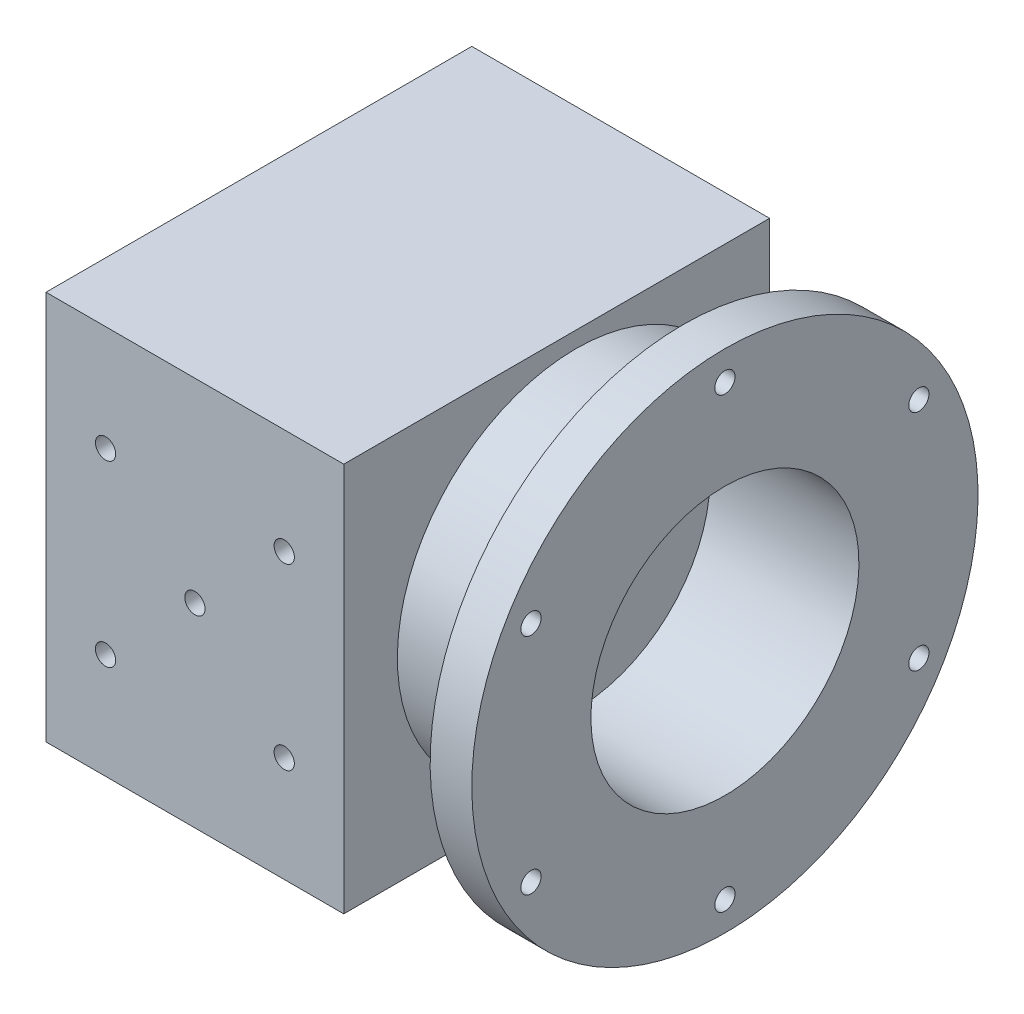
from build123d import *

# Parameters (mm, degrees)
CROQUIS1_W                            = 50
CROQUIS1_H                            = 65.4
SALIENTE_EXTRUIR1_DEPTH               = 35.75
CROQUIS2_R                            = 30
CROQUIS2_R_2                          = 22.5
SALIENTE_EXTRUIR2_DEPTH               = 25
CROQUIS3_R                            = 42.5
CROQUIS3_R_2                          = 30
SALIENTE_EXTRUIR3_DEPTH               = 7
CROQUIS5_W                            = 1.7
CROQUIS5_H                            = 7.001
TALADRO_DE_MARGEN_PARA_M31_AT_2_COUNT = 2
TALADRO_DE_MARGEN_PARA_M31_AT_2_PITCH = 37.6
TALADRO_DE_MARGEN_PARA_M31_AT_3_COUNT = 2
TALADRO_DE_MARGEN_PARA_M31_AT_3_PITCH = 65.125110365
TALADRO_DE_MARGEN_PARA_M31_AT_4_COUNT = 2
TALADRO_DE_MARGEN_PARA_M31_AT_4_PITCH = 75.2
TALADRO_DE_MARGEN_PARA_M31_AT_5_COUNT = 2
TALADRO_DE_MARGEN_PARA_M31_AT_5_PITCH = 65.125110365
TALADRO_DE_MARGEN_PARA_M31_AT_6_COUNT = 2
TALADRO_DE_MARGEN_PARA_M31_AT_6_PITCH = 37.6
CROQUIS12_W                           = 1.7
CROQUIS12_H                           = 81.5
TALADRO_DE_MARGEN_PARA_M32_AT_2_COUNT = 2
TALADRO_DE_MARGEN_PARA_M32_AT_2_PITCH = 42.426406871
TALADRO_DE_MARGEN_PARA_M32_AT_3_COUNT = 2
TALADRO_DE_MARGEN_PARA_M32_AT_3_PITCH = 30
TALADRO_DE_MARGEN_PARA_M32_AT_4_COUNT = 2
TALADRO_DE_MARGEN_PARA_M32_AT_4_PITCH = 30
TALADRO_DE_MARGEN_PARA_M32_AT_5_COUNT = 2
TALADRO_DE_MARGEN_PARA_M32_AT_5_PITCH = 21.213203436


with BuildPart() as part:
    # Croquis1 → Saliente-Extruir1 (new, symmetric)
    with BuildSketch(Plane.XY):
        Rectangle(CROQUIS1_W, CROQUIS1_H)
    extrude(amount=SALIENTE_EXTRUIR1_DEPTH, both=True)

    # Croquis12 → Taladro de margen para M32 (revolve, cut)
    with BuildSketch(Plane(origin=(15, 15, 35.75), x_dir=(0, -1, 0), z_dir=(1, 0, 0))):
        with Locations((0.85, 40.75)):
            Rectangle(CROQUIS12_W, CROQUIS12_H)
    taladro_de_margen_para_m32 = revolve(axis=Axis((15, 15, 42.1), (0, 0, -1)), mode=Mode.SUBTRACT)

    # Taladro de margen para M32 at 2: Taladro de margen para M32 ×2
    with Locations(*[Vector(-0.7071067811865475, -0.7071067811865476, 0) * (i * TALADRO_DE_MARGEN_PARA_M32_AT_2_PITCH) for i in range(1, TALADRO_DE_MARGEN_PARA_M32_AT_2_COUNT)]):
        add(taladro_de_margen_para_m32, mode=Mode.SUBTRACT)

    # Taladro de margen para M32 at 3: Taladro de margen para M32 ×2
    with Locations(*[(-i * TALADRO_DE_MARGEN_PARA_M32_AT_3_PITCH, 0, 0) for i in range(1, TALADRO_DE_MARGEN_PARA_M32_AT_3_COUNT)]):
        add(taladro_de_margen_para_m32, mode=Mode.SUBTRACT)

    # Taladro de margen para M32 at 4: Taladro de margen para M32 ×2
    with Locations(*[(0, -i * TALADRO_DE_MARGEN_PARA_M32_AT_4_PITCH, 0) for i in range(1, TALADRO_DE_MARGEN_PARA_M32_AT_4_COUNT)]):
        add(taladro_de_margen_para_m32, mode=Mode.SUBTRACT)

    # Taladro de margen para M32 at 5: Taladro de margen para M32 ×2
    with Locations(*[Vector(-0.7071067811865476, -0.7071067811865476, 0) * (i * TALADRO_DE_MARGEN_PARA_M32_AT_5_PITCH) for i in range(1, TALADRO_DE_MARGEN_PARA_M32_AT_5_COUNT)]):
        add(taladro_de_margen_para_m32, mode=Mode.SUBTRACT)


with BuildPart() as body_2:
    # Croquis2 → Saliente-Extruir2 (new body)
    with BuildSketch(Plane(origin=(25, 0, 0), x_dir=(0, 0, -1), z_dir=(1, 0, 0))):
        with Locations((3.25, 0)):
            Circle(CROQUIS2_R)
        with Locations((3.25, 0)):
            Circle(CROQUIS2_R_2, mode=Mode.SUBTRACT)
    extrude(amount=SALIENTE_EXTRUIR2_DEPTH)

    # Croquis3 → Saliente-Extruir3 (add)
    with BuildSketch(Plane(origin=(50, 0, 0), x_dir=(0, 0, -1), z_dir=(1, 0, 0))):
        with Locations((3.25, 0)):
            Circle(CROQUIS3_R)
        with Locations((3.25, 0)):
            Circle(CROQUIS3_R_2, mode=Mode.SUBTRACT)
    extrude(amount=-SALIENTE_EXTRUIR3_DEPTH)

    # Croquis5 → Taladro de margen para M31 (revolve, cut)
    with BuildSketch(Plane(origin=(50, 18.8, 29.312555182), x_dir=(0, 0, -1), z_dir=(0, 1, 0))):
        with Locations((0.85, 3.5005)):
            Rectangle(CROQUIS5_W, CROQUIS5_H)
    taladro_de_margen_para_m31 = revolve(axis=Axis((56.35, 18.8, 29.312555182), (-1, 0, 0)), mode=Mode.SUBTRACT)

    # Taladro de margen para M31 at 2: Taladro de margen para M31 ×2
    with Locations(*[Vector(0, 0.4999999999999999, -0.8660254037844386) * (i * TALADRO_DE_MARGEN_PARA_M31_AT_2_PITCH) for i in range(1, TALADRO_DE_MARGEN_PARA_M31_AT_2_COUNT)]):
        add(taladro_de_margen_para_m31, mode=Mode.SUBTRACT)

    # Taladro de margen para M31 at 3: Taladro de margen para M31 ×2
    with Locations(*[(0, 0, -i * TALADRO_DE_MARGEN_PARA_M31_AT_3_PITCH) for i in range(1, TALADRO_DE_MARGEN_PARA_M31_AT_3_COUNT)]):
        add(taladro_de_margen_para_m31, mode=Mode.SUBTRACT)

    # Taladro de margen para M31 at 4: Taladro de margen para M31 ×2
    with Locations(*[Vector(0, -0.49999999999999994, -0.8660254037844387) * (i * TALADRO_DE_MARGEN_PARA_M31_AT_4_PITCH) for i in range(1, TALADRO_DE_MARGEN_PARA_M31_AT_4_COUNT)]):
        add(taladro_de_margen_para_m31, mode=Mode.SUBTRACT)

    # Taladro de margen para M31 at 5: Taladro de margen para M31 ×2
    with Locations(*[Vector(0, -0.8660254037844387, -0.5) * (i * TALADRO_DE_MARGEN_PARA_M31_AT_5_PITCH) for i in range(1, TALADRO_DE_MARGEN_PARA_M31_AT_5_COUNT)]):
        add(taladro_de_margen_para_m31, mode=Mode.SUBTRACT)

    # Taladro de margen para M31 at 6: Taladro de margen para M31 ×2
    with Locations(*[(0, -i * TALADRO_DE_MARGEN_PARA_M31_AT_6_PITCH, 0) for i in range(1, TALADRO_DE_MARGEN_PARA_M31_AT_6_COUNT)]):
        add(taladro_de_margen_para_m31, mode=Mode.SUBTRACT)


solid = Compound([part.part, body_2.part])
